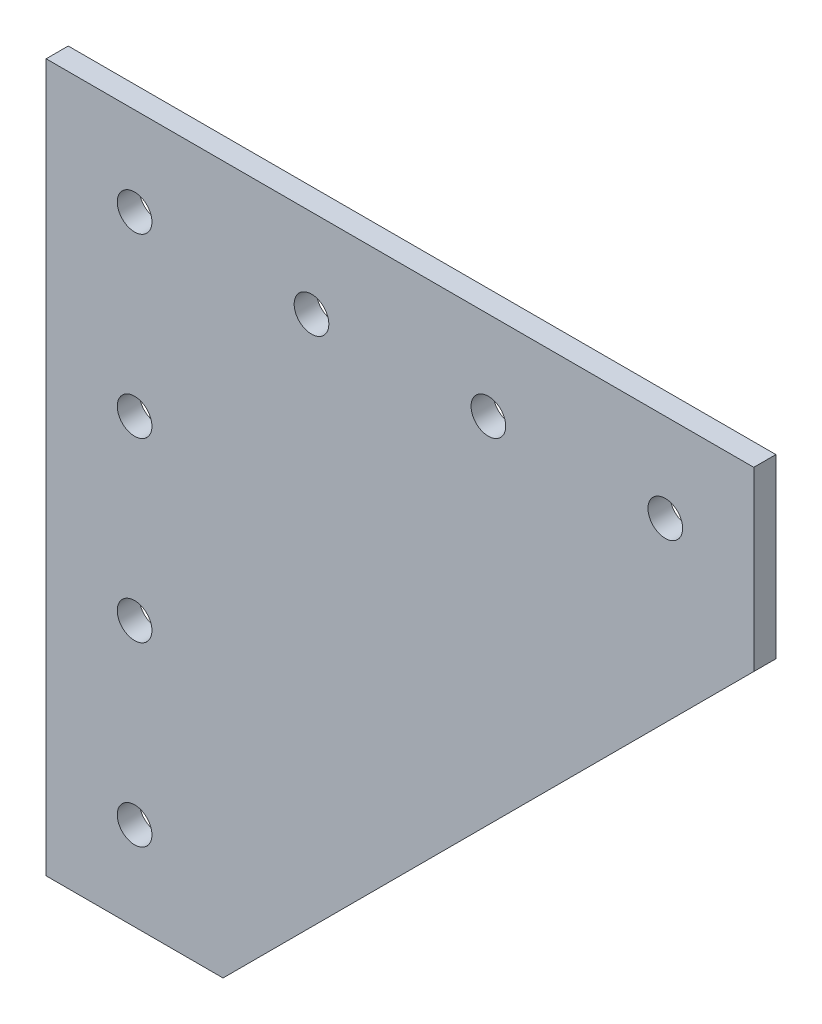
from build123d import *

# Parameters (mm, degrees)
BOSS_EXTRUDE1_DEPTH = 3.175
SKETCH2_R           = 2.4892
CUT_EXTRUDE1_DEPTH  = 144.719172782


with BuildPart() as part:
    # Sketch1 → Boss-Extrude1 (new body)
    with BuildSketch(Plane.XY):
        Polygon((0, 0), (0, 101.6), (101.6, 101.6), (101.6, 76.2), (25.4, 0), align=None)
    extrude(amount=BOSS_EXTRUDE1_DEPTH)

    # Sketch2 → Cut-Extrude1 (cut, through all)
    with BuildSketch(Plane.XY.offset(3.175)):
        with Locations((12.7, 88.9)):
            Circle(SKETCH2_R)
        with Locations((38.1, 88.9)):
            Circle(SKETCH2_R)
        with Locations((63.5, 88.9)):
            Circle(SKETCH2_R)
        with Locations((88.9, 88.9)):
            Circle(SKETCH2_R)
        with Locations((12.7, 63.5)):
            Circle(SKETCH2_R)
        with Locations((12.7, 38.1)):
            Circle(SKETCH2_R)
        with Locations((12.7, 12.7)):
            Circle(SKETCH2_R)
    extrude(amount=-CUT_EXTRUDE1_DEPTH, mode=Mode.SUBTRACT)


solid = part.part
